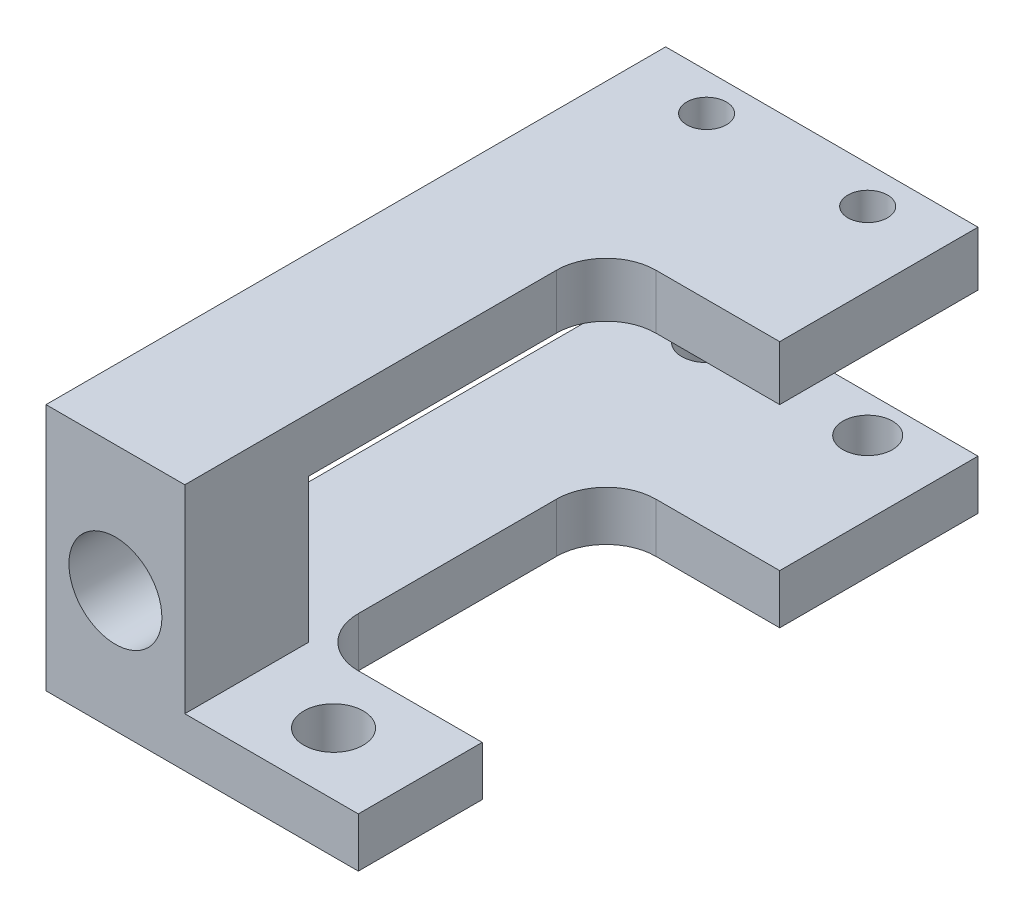
from build123d import *

# Parameters (mm, degrees)
SKETCH1_W                   = 12.6
SKETCH1_H                   = 25
BOSS_EXTRUDE1_DEPTH         = 10
SKETCH14_W                  = 7
SKETCH14_H                  = 5.8
CUT_EXTRUDE9_DEPTH          = 28.653028767
SKETCH15_W                  = 20
SKETCH15_H                  = 5.8
CUT_EXTRUDE10_DEPTH         = 18.47140521
CUT_EXTRUDE11_DEPTH         = 17.122654868
CUT_EXTRUDE11_DEPTH_BACK    = 17.122654868
SKETCH17_W                  = 7
SKETCH17_H                  = 12
SKETCH18_R                  = 1.875
CUT_EXTRUDE12_DEPTH         = 24.231228982
SKETCH19_W                  = 7
SKETCH19_H                  = 5
CUT_EXTRUDE13_DEPTH         = 2.2
FILLET2_R                   = 2
SKETCH20_R                  = 1
CUT_EXTRUDE18_DEPTH         = 5
TAP_DRILL_FOR_M2X0_4_TAP2_D = 1.6
M2_CLEARANCE_HOLE2_D        = 2.4


with BuildPart() as part:
    # Sketch1 → Boss-Extrude1 (new body)
    with BuildSketch(Plane(origin=(0, 0, 0), x_dir=(1, 0, 0), z_dir=(0, 1, 0))):
        Rectangle(SKETCH1_W, SKETCH1_H)
    extrude(amount=BOSS_EXTRUDE1_DEPTH)

    # Sketch14 → Cut-Extrude9 (cut, through all)
    with BuildSketch(Plane.XY.offset(12.5)):
        with Locations((2.8, 4.9)):
            Rectangle(SKETCH14_W, SKETCH14_H)
    extrude(amount=-CUT_EXTRUDE9_DEPTH, mode=Mode.SUBTRACT)

    # Sketch15 → Cut-Extrude10 (cut, through all)
    with BuildSketch(Plane(origin=(-0.7, 0, 0), x_dir=(0, 0, -1), z_dir=(1, 0, 0))):
        with Locations((2.5, 4.9)):
            Rectangle(SKETCH15_W, SKETCH15_H)
    extrude(amount=-CUT_EXTRUDE10_DEPTH, mode=Mode.SUBTRACT)

    # Sketch17 → Cut-Extrude11 (cut, two sides: drawn at the far end of the back side and taken through both)
    with BuildSketch(Plane(origin=(0, 2, 0), x_dir=(1, 0, 0), z_dir=(0, 1, 0)).offset(-CUT_EXTRUDE11_DEPTH_BACK)):
        with Locations((2.8, -1.5)):
            Rectangle(SKETCH17_W, SKETCH17_H)
    extrude(amount=CUT_EXTRUDE11_DEPTH + CUT_EXTRUDE11_DEPTH_BACK, mode=Mode.SUBTRACT)

    # Sketch18 → Cut-Extrude12 (cut, through all)
    with BuildSketch(Plane(origin=(0, 0, 7.5), x_dir=(-1, 0, 0), z_dir=(0, 0, -1))):
        with Locations(Location((3.5, 4.9, 0), (0, 0, 90))):
            Circle(SKETCH18_R)
    extrude(amount=-CUT_EXTRUDE12_DEPTH, mode=Mode.SUBTRACT)

    # Sketch19 → Cut-Extrude13 (cut)
    with BuildSketch(Plane(origin=(0, 10, 0), x_dir=(1, 0, 0), z_dir=(0, 1, 0))):
        with Locations((2.8, -10)):
            Rectangle(SKETCH19_W, SKETCH19_H)
    extrude(amount=-CUT_EXTRUDE13_DEPTH, mode=Mode.SUBTRACT)

    # Fillet2
    # the kernel refuses this fillet: 2 mm, written as the material it adds along each edge
    with BuildSketch(Plane(origin=(-0.7, 2, -4.5), x_dir=(1, 0, 0), z_dir=(0, -1, 0)), Plane(origin=(-0.7, 2, 7.5), x_dir=(0, 0, -1), z_dir=(0, -1, 0))) as fillet2_piece_1:
        with BuildLine():
            CenterArc((FILLET2_R, FILLET2_R), FILLET2_R, 180, 90)
            Line((0, FILLET2_R), (0, 0))
            Line((0, 0), (FILLET2_R, 0))
        make_face()
    extrude(amount=2)
    with BuildSketch(Plane(origin=(-0.7, 10, -4.5), x_dir=(1, 0, 0), z_dir=(0, -1, 0))) as fillet2_piece_2:
        with BuildLine():
            CenterArc((FILLET2_R, FILLET2_R), FILLET2_R, 180, 90)
            Line((0, FILLET2_R), (0, 0))
            Line((0, 0), (FILLET2_R, 0))
        make_face()
    extrude(amount=2.2)

    # Sketch20 → Cut-Extrude18 (cut)
    with BuildSketch(Plane.XZ):
        with Locations(Location((3.35, -11, 0), (0, 0, 270))):
            Circle(SKETCH20_R)
        with Locations(Location((-3.15, -11, 0), (0, 0, 270))):
            Circle(SKETCH20_R)
    extrude(amount=-CUT_EXTRUDE18_DEPTH, mode=Mode.SUBTRACT)

    # Tap Drill for M2x0.4 Tap2 (through all)
    with Locations(Plane(origin=(3.35, 10, -11), x_dir=(0, 0, 1), z_dir=(0, 1, 0))):
        with Locations((0, 0), (0, -6.5)):
            Hole(TAP_DRILL_FOR_M2X0_4_TAP2_D / 2)

    # M2 Clearance Hole2 (through all)
    with Locations(Plane(origin=(2.8, 2, 10), x_dir=(1, 0, 0), z_dir=(0, 1, 0))):
        with Locations((0, 0)):
            Hole(M2_CLEARANCE_HOLE2_D / 2)


solid = part.part
